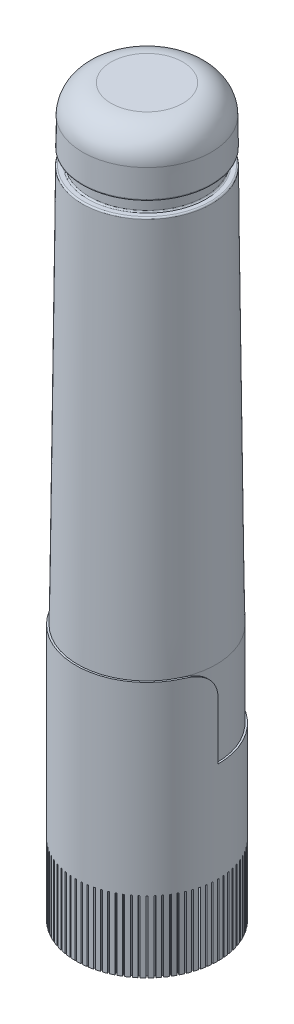
from build123d import *

# Parameters (mm, degrees)
SKETCH1_R           = 5
BOSS_EXTRUDE1_DEPTH = 18
SKETCH2_W           = 0.1
SKETCH2_H           = 0.3440202
SKETCH2_W_2         = 0.3440202
SKETCH2_H_2         = 0.1
CUT_EXTRUDE1_DEPTH  = 5
SKETCH3_W           = 10
SKETCH3_H           = 5
CUT_EXTRUDE2_DEPTH  = 6
FILLET2_R           = 2
SKETCH4_R           = 4.875
BOSS_EXTRUDE2_DEPTH = 6
FILLET6_R           = 2
SKETCH8_W           = 0.75
SKETCH8_H           = 1
FILLET7_R           = 0.1


with BuildPart() as part:
    # Sketch1 → Boss-Extrude1 (new body)
    with BuildSketch(Plane(origin=(0, 0, 0), x_dir=(1, 0, 0), z_dir=(0, 1, 0))):
        with Locations(Location((0, 0, 0), (0, 0, 270))):
            Circle(SKETCH1_R)
    extrude(amount=BOSS_EXTRUDE1_DEPTH)

    # Sketch2 → Cut-Extrude1 (cut)
    with BuildSketch(Plane(origin=(0, 0, 0), x_dir=(-1, 0, 0), z_dir=(0, -1, 0))):
        Polygon((-0.355945369, -5.159989473), (-0.455637102, -5.152143564), (-0.428645588, -4.809183864), (-0.328953855, -4.817029774), align=None)
        with Locations((0, -5)):
            Rectangle(SKETCH2_W, SKETCH2_H)
        Polygon((-0.759696216, -5.116155796), (-0.85846505, -5.10051235), (-0.804648434, -4.76072761), (-0.7058796, -4.776371056), align=None)
        Polygon((-1.158763284, -5.040779317), (-1.256000276, -5.017434781), (-1.175690355, -4.682919887), (-1.078453363, -4.706264423), align=None)
        Polygon((-1.55068619, -4.934324757), (-1.645791842, -4.903423058), (-1.539483754, -4.576240406), (-1.444378102, -4.607142105), align=None)
        Polygon((-1.933048601, -4.797448445), (-2.025436554, -4.759180101), (-1.893785723, -4.441346881), (-1.80139777, -4.479615224), align=None)
        Polygon((-2.303493124, -4.630994267), (-2.392593776, -4.585595217), (-2.236411874, -4.279070975), (-2.147311221, -4.324470025), align=None)
        Polygon((-2.659735846, -4.43598847), (-2.744999862, -4.383738613), (-2.565249802, -4.090413174), (-2.479985785, -4.14266303), align=None)
        Polygon((-2.999580412, -4.213633328), (-3.080482111, -4.154854803), (-2.878272111, -3.876536615), (-2.797370412, -3.935315141), align=None)
        Polygon((-3.320931567, -3.965299736), (-3.396972163, -3.900354931), (-3.173548916, -3.63875992), (-3.09750832, -3.703704725), align=None)
        Polygon((-3.621808075, -3.692518753), (-3.692518753, -3.621808075), (-3.449259737, -3.378549059), (-3.378549059, -3.449259737), align=None)
        Polygon((-3.900354931, -3.396972163), (-3.965299736, -3.320931567), (-3.703704725, -3.09750832), (-3.63875992, -3.173548916), align=None)
        Polygon((-4.154854803, -3.080482111), (-4.213633328, -2.999580412), (-3.935315141, -2.797370412), (-3.876536615, -2.878272111), align=None)
        Polygon((-4.383738613, -2.744999862), (-4.43598847, -2.659735846), (-4.14266303, -2.479985785), (-4.090413174, -2.565249802), align=None)
        Polygon((-4.585595217, -2.392593776), (-4.630994267, -2.303493124), (-4.324470025, -2.147311221), (-4.279070975, -2.236411874), align=None)
        Polygon((-4.759180101, -2.025436554), (-4.797448445, -1.933048601), (-4.479615224, -1.80139777), (-4.441346881, -1.893785723), align=None)
        Polygon((-4.903423058, -1.645791842), (-4.934324757, -1.55068619), (-4.607142105, -1.444378102), (-4.576240406, -1.539483754), align=None)
        Polygon((-5.017434781, -1.256000276), (-5.040779317, -1.158763284), (-4.706264423, -1.078453363), (-4.682919887, -1.175690355), align=None)
        Polygon((-5.10051235, -0.85846505), (-5.116155796, -0.759696216), (-4.776371056, -0.7058796), (-4.76072761, -0.804648434), align=None)
        Polygon((-5.152143564, -0.455637102), (-5.159989473, -0.355945369), (-4.817029774, -0.328953855), (-4.809183864, -0.428645588), align=None)
        with Locations((-5, 0)):
            Rectangle(SKETCH2_W_2, SKETCH2_H_2)
        Polygon((-5.159989473, 0.355945369), (-5.152143564, 0.455637102), (-4.809183864, 0.428645588), (-4.817029774, 0.328953855), align=None)
        Polygon((-5.116155796, 0.759696216), (-5.10051235, 0.85846505), (-4.76072761, 0.804648434), (-4.776371056, 0.7058796), align=None)
        Polygon((-5.040779317, 1.158763284), (-5.017434781, 1.256000276), (-4.682919887, 1.175690355), (-4.706264423, 1.078453363), align=None)
        Polygon((-4.934324757, 1.55068619), (-4.903423058, 1.645791842), (-4.576240406, 1.539483754), (-4.607142105, 1.444378102), align=None)
        Polygon((-4.797448445, 1.933048601), (-4.759180101, 2.025436554), (-4.441346881, 1.893785723), (-4.479615224, 1.80139777), align=None)
        Polygon((-4.630994267, 2.303493124), (-4.585595217, 2.392593776), (-4.279070975, 2.236411874), (-4.324470025, 2.147311221), align=None)
        Polygon((-4.43598847, 2.659735846), (-4.383738613, 2.744999862), (-4.090413174, 2.565249802), (-4.14266303, 2.479985785), align=None)
        Polygon((-4.213633328, 2.999580412), (-4.154854803, 3.080482111), (-3.876536615, 2.878272111), (-3.935315141, 2.797370412), align=None)
        Polygon((-3.965299736, 3.320931567), (-3.900354931, 3.396972163), (-3.63875992, 3.173548916), (-3.703704725, 3.09750832), align=None)
        Polygon((-3.692518753, 3.621808075), (-3.621808075, 3.692518753), (-3.378549059, 3.449259737), (-3.449259737, 3.378549059), align=None)
        Polygon((-3.396972163, 3.900354931), (-3.320931567, 3.965299736), (-3.09750832, 3.703704725), (-3.173548916, 3.63875992), align=None)
        Polygon((-3.080482111, 4.154854803), (-2.999580412, 4.213633328), (-2.797370412, 3.935315141), (-2.878272111, 3.876536615), align=None)
        Polygon((-2.744999862, 4.383738613), (-2.659735846, 4.43598847), (-2.479985785, 4.14266303), (-2.565249802, 4.090413174), align=None)
        Polygon((-2.392593776, 4.585595217), (-2.303493124, 4.630994267), (-2.147311221, 4.324470025), (-2.236411874, 4.279070975), align=None)
        Polygon((-2.025436554, 4.759180101), (-1.933048601, 4.797448445), (-1.80139777, 4.479615224), (-1.893785723, 4.441346881), align=None)
        Polygon((-1.645791842, 4.903423058), (-1.55068619, 4.934324757), (-1.444378102, 4.607142105), (-1.539483754, 4.576240406), align=None)
        Polygon((-1.256000276, 5.017434781), (-1.158763284, 5.040779317), (-1.078453363, 4.706264423), (-1.175690355, 4.682919887), align=None)
        Polygon((-0.85846505, 5.10051235), (-0.759696216, 5.116155796), (-0.7058796, 4.776371056), (-0.804648434, 4.76072761), align=None)
        Polygon((-0.455637102, 5.152143564), (-0.355945369, 5.159989473), (-0.328953855, 4.817029774), (-0.428645588, 4.809183864), align=None)
        with Locations((0, 5)):
            Rectangle(SKETCH2_W, SKETCH2_H)
        Polygon((0.355945369, 5.159989473), (0.455637102, 5.152143564), (0.428645588, 4.809183864), (0.328953855, 4.817029774), align=None)
        Polygon((0.759696216, 5.116155796), (0.85846505, 5.10051235), (0.804648434, 4.76072761), (0.7058796, 4.776371056), align=None)
        Polygon((1.158763284, 5.040779317), (1.256000276, 5.017434781), (1.175690355, 4.682919887), (1.078453363, 4.706264423), align=None)
        Polygon((1.55068619, 4.934324757), (1.645791842, 4.903423058), (1.539483754, 4.576240406), (1.444378102, 4.607142105), align=None)
        Polygon((1.933048601, 4.797448445), (2.025436554, 4.759180101), (1.893785723, 4.441346881), (1.80139777, 4.479615224), align=None)
        Polygon((2.303493124, 4.630994267), (2.392593776, 4.585595217), (2.236411874, 4.279070975), (2.147311221, 4.324470025), align=None)
        Polygon((2.659735846, 4.43598847), (2.744999862, 4.383738613), (2.565249802, 4.090413174), (2.479985785, 4.14266303), align=None)
        Polygon((2.999580412, 4.213633328), (3.080482111, 4.154854803), (2.878272111, 3.876536615), (2.797370412, 3.935315141), align=None)
        Polygon((3.320931567, 3.965299736), (3.396972163, 3.900354931), (3.173548916, 3.63875992), (3.09750832, 3.703704725), align=None)
        Polygon((3.621808075, 3.692518753), (3.692518753, 3.621808075), (3.449259737, 3.378549059), (3.378549059, 3.449259737), align=None)
        Polygon((3.900354931, 3.396972163), (3.965299736, 3.320931567), (3.703704725, 3.09750832), (3.63875992, 3.173548916), align=None)
        Polygon((4.154854803, 3.080482111), (4.213633328, 2.999580412), (3.935315141, 2.797370412), (3.876536615, 2.878272111), align=None)
        Polygon((4.383738613, 2.744999862), (4.43598847, 2.659735846), (4.14266303, 2.479985785), (4.090413174, 2.565249802), align=None)
        Polygon((4.585595217, 2.392593776), (4.630994267, 2.303493124), (4.324470025, 2.147311221), (4.279070975, 2.236411874), align=None)
        Polygon((4.759180101, 2.025436554), (4.797448445, 1.933048601), (4.479615224, 1.80139777), (4.441346881, 1.893785723), align=None)
        Polygon((4.903423058, 1.645791842), (4.934324757, 1.55068619), (4.607142105, 1.444378102), (4.576240406, 1.539483754), align=None)
        Polygon((5.017434781, 1.256000276), (5.040779317, 1.158763284), (4.706264423, 1.078453363), (4.682919887, 1.175690355), align=None)
        Polygon((5.10051235, 0.85846505), (5.116155796, 0.759696216), (4.776371056, 0.7058796), (4.76072761, 0.804648434), align=None)
        Polygon((5.152143564, 0.455637102), (5.159989473, 0.355945369), (4.817029774, 0.328953855), (4.809183864, 0.428645588), align=None)
        with Locations((5, 0)):
            Rectangle(SKETCH2_W_2, SKETCH2_H_2)
        Polygon((5.159989473, -0.355945369), (5.152143564, -0.455637102), (4.809183864, -0.428645588), (4.817029774, -0.328953855), align=None)
        Polygon((5.116155796, -0.759696216), (5.10051235, -0.85846505), (4.76072761, -0.804648434), (4.776371056, -0.7058796), align=None)
        Polygon((5.040779317, -1.158763284), (5.017434781, -1.256000276), (4.682919887, -1.175690355), (4.706264423, -1.078453363), align=None)
        Polygon((4.934324757, -1.55068619), (4.903423058, -1.645791842), (4.576240406, -1.539483754), (4.607142105, -1.444378102), align=None)
        Polygon((4.797448445, -1.933048601), (4.759180101, -2.025436554), (4.441346881, -1.893785723), (4.479615224, -1.80139777), align=None)
        Polygon((4.630994267, -2.303493124), (4.585595217, -2.392593776), (4.279070975, -2.236411874), (4.324470025, -2.147311221), align=None)
        Polygon((4.43598847, -2.659735846), (4.383738613, -2.744999862), (4.090413174, -2.565249802), (4.14266303, -2.479985785), align=None)
        Polygon((4.213633328, -2.999580412), (4.154854803, -3.080482111), (3.876536615, -2.878272111), (3.935315141, -2.797370412), align=None)
        Polygon((3.965299736, -3.320931567), (3.900354931, -3.396972163), (3.63875992, -3.173548916), (3.703704725, -3.09750832), align=None)
        Polygon((3.692518753, -3.621808075), (3.621808075, -3.692518753), (3.378549059, -3.449259737), (3.449259737, -3.378549059), align=None)
        Polygon((3.396972163, -3.900354931), (3.320931567, -3.965299736), (3.09750832, -3.703704725), (3.173548916, -3.63875992), align=None)
        Polygon((3.080482111, -4.154854803), (2.999580412, -4.213633328), (2.797370412, -3.935315141), (2.878272111, -3.876536615), align=None)
        Polygon((2.744999862, -4.383738613), (2.659735846, -4.43598847), (2.479985785, -4.14266303), (2.565249802, -4.090413174), align=None)
        Polygon((2.392593776, -4.585595217), (2.303493124, -4.630994267), (2.147311221, -4.324470025), (2.236411874, -4.279070975), align=None)
        Polygon((2.025436554, -4.759180101), (1.933048601, -4.797448445), (1.80139777, -4.479615224), (1.893785723, -4.441346881), align=None)
        Polygon((1.645791842, -4.903423058), (1.55068619, -4.934324757), (1.444378102, -4.607142105), (1.539483754, -4.576240406), align=None)
        Polygon((1.256000276, -5.017434781), (1.158763284, -5.040779317), (1.078453363, -4.706264423), (1.175690355, -4.682919887), align=None)
        Polygon((0.85846505, -5.10051235), (0.759696216, -5.116155796), (0.7058796, -4.776371056), (0.804648434, -4.76072761), align=None)
        Polygon((0.455637102, -5.152143564), (0.355945369, -5.159989473), (0.328953855, -4.817029774), (0.428645588, -4.809183864), align=None)
    extrude(amount=-CUT_EXTRUDE1_DEPTH, mode=Mode.SUBTRACT)

    # Sketch3 → Cut-Extrude2 (cut)
    with BuildSketch(Plane(origin=(0, 18, 0), x_dir=(1, 0, 0), z_dir=(0, 1, 0))):
        with Locations((0, 2.5)):
            Rectangle(SKETCH3_W, SKETCH3_H)
    extrude(amount=-CUT_EXTRUDE2_DEPTH, mode=Mode.SUBTRACT)

    # Fillet2
    fillet2_edges = [part.edges().sort_by_distance(p)[0] for p in [
        (0, 18, 0),
    ]]
    fillet(fillet2_edges, radius=FILLET2_R)

    # Sketch4 → Boss-Extrude2 (add)
    with BuildSketch(Plane(origin=(0, 12, 0), x_dir=(1, 0, 0), z_dir=(0, 1, 0))):
        Circle(SKETCH4_R)
    extrude(amount=BOSS_EXTRUDE2_DEPTH)

    # Sketch7 → Revolve1 (revolve)
    with BuildSketch(Plane(origin=(0, 0, 0), x_dir=(0, 0, -1), z_dir=(1, 0, 0)), mode=Mode.PRIVATE) as revolve1_sk:
        Polygon((0, 18), (0, 51), (4.5, 51), (4.875, 18), align=None)
    revolve(revolve1_sk.sketch.rotate(Axis((0, 18, 0), (0, 1, 0)), 359.427032655), axis=Axis((0, 18, 0), (0, 1, 0)))

    # Fillet6
    fillet6_edges = [part.edges().sort_by_distance(p)[0] for p in [
        (-0.045, 51, 4.499774994),
    ]]
    fillet(fillet6_edges, radius=FILLET6_R)

    # Sketch8 → Cut-Revolve3 (revolve, cut)
    with BuildSketch(Plane(origin=(0, 0, 0), x_dir=(0, 0, -1), z_dir=(1, 0, 0)), mode=Mode.PRIVATE) as cut_revolve3_sk:
        with Locations((4.447598145, 46.5)):
            Rectangle(SKETCH8_W, SKETCH8_H)
    revolve(cut_revolve3_sk.sketch.rotate(Axis((0, 51, 0), (0, -0.9999995194159559, -0.0009803916857022733)), 305.531509198), axis=Axis((0, 51, 0), (0, -0.9999995194159559, -0.0009803916857022733)), mode=Mode.SUBTRACT)

    # Fillet7
    fillet7_edges = [part.edges().sort_by_distance(p)[0] for p in [
        (3.31107131, 46.993692957, 2.360586008),
        (2.06327518, 45.991539957, 4.063048562),
        (3.310273471, 45.993694476, 2.359035862),
        (2.058481086, 46.991563025, 4.05273784),
    ]]
    fillet(fillet7_edges, radius=FILLET7_R)


solid = part.part
